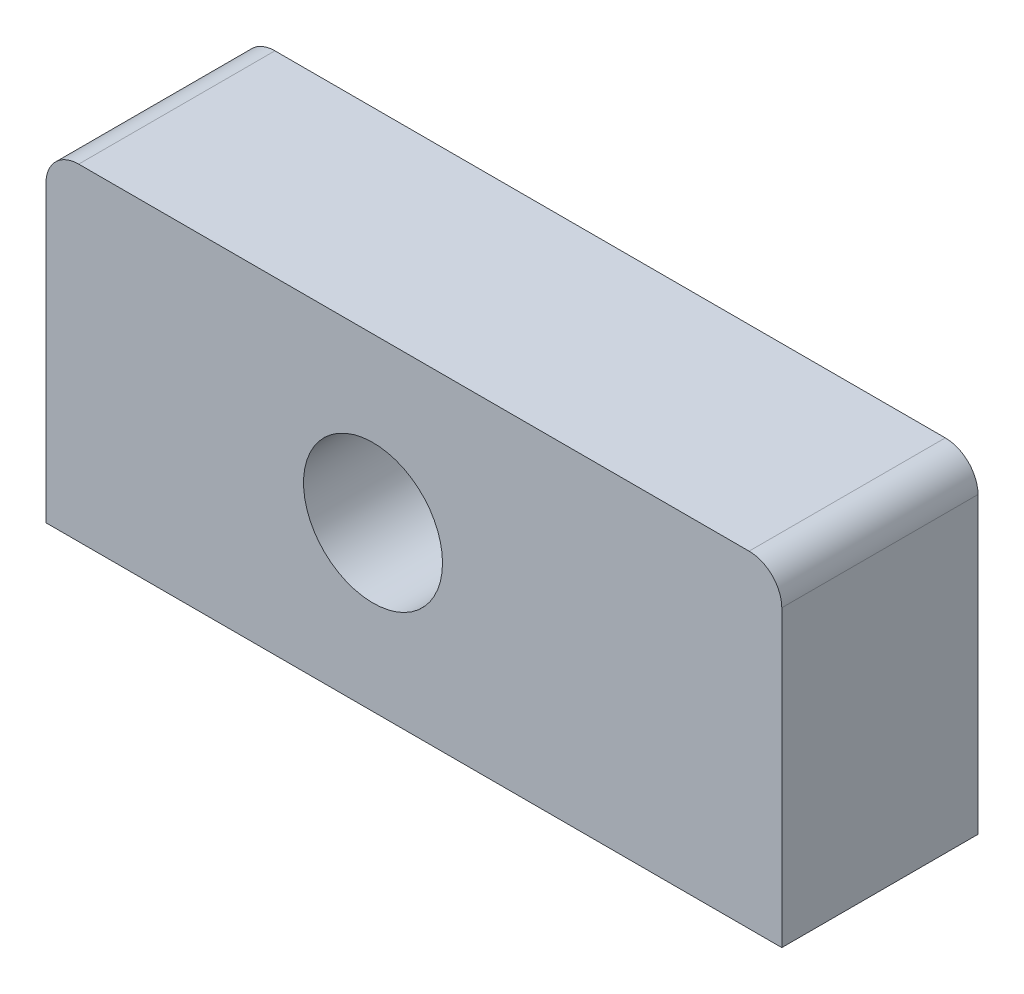
from build123d import *

# Parameters (mm, degrees)
SKETCH1_W           = 45
SKETCH1_H           = 20
SKETCH1_R           = 4.25
BOSS_EXTRUDE1_DEPTH = 12
FILLET1_R           = 2
SKETCH2_R           = 1.5
CUT_EXTRUDE1_DEPTH  = 5


with BuildPart() as part:
    # Sketch1 → Boss-Extrude1 (new body)
    with BuildSketch(Plane.XY):
        with Locations((22.5, 10)):
            Rectangle(SKETCH1_W, SKETCH1_H)
        with Locations((20, 10)):
            Circle(SKETCH1_R, mode=Mode.SUBTRACT)
    extrude(amount=BOSS_EXTRUDE1_DEPTH)

    # Fillet1
    fillet1_edges = [part.edges().sort_by_distance(p)[0] for p in [
        (45, 20, 6),
        (0, 20, 6),
    ]]
    fillet(fillet1_edges, radius=FILLET1_R)

    # Sketch2 → Cut-Extrude1 (cut)
    with BuildSketch(Plane.XZ):
        with Locations((5, 6)):
            Circle(SKETCH2_R)
        with Locations((35, 6)):
            Circle(SKETCH2_R)
    extrude(amount=-CUT_EXTRUDE1_DEPTH, mode=Mode.SUBTRACT)


solid = part.part
